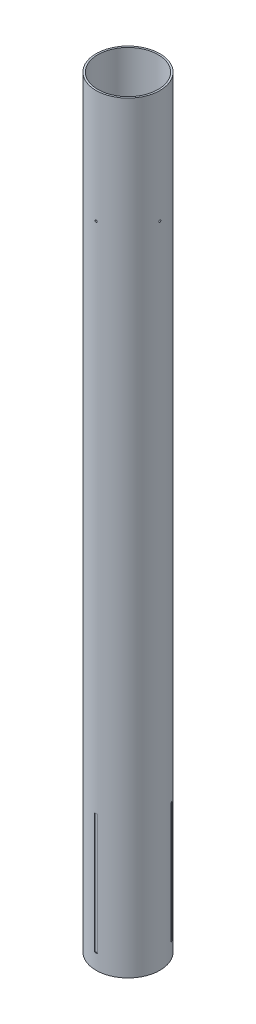
from build123d import *

# Parameters (mm, degrees)
SKETCH1_R               = 53.721
SKETCH1_R_2             = 50.8
TUBE_EXTRUSION_DEPTH    = 1282.7
ENGINE_BLOCK_HOLE_REACH = 1290.312
SKETCH2_R               = 1.6383
CIRPATTERN1_COUNT       = 4
SKETCH3_W               = 5.334
SKETCH3_H               = 203.2
FIN_SLOTS_DEPTH         = 1.27
CIRPATTERN2_COUNT       = 3


with BuildPart() as part:
    # Sketch1 → Tube Extrusion (new body)
    with BuildSketch(Plane(origin=(0, 0, 0), x_dir=(1, 0, 0), z_dir=(0, 1, 0))):
        Circle(SKETCH1_R)
        Circle(SKETCH1_R_2, mode=Mode.SUBTRACT)
    extrude(amount=TUBE_EXTRUSION_DEPTH)

    # Sketch2 → Engine Block Hole (cut, up to next)
    with BuildSketch(Plane.XY.offset(53.721), mode=Mode.PRIVATE) as engine_block_hole_sk1:
        with Locations((0, 1092.2)):
            Circle(SKETCH2_R)
    engine_block_hole_tool1 = extrude(engine_block_hole_sk1.sketch, amount=-ENGINE_BLOCK_HOLE_REACH, mode=Mode.PRIVATE) & part.part
    engine_block_hole = engine_block_hole_tool1.solids().sort_by_distance((0, 1092.2, 53.721))[0]
    add(engine_block_hole, mode=Mode.SUBTRACT)

    # CirPattern1: Engine Block Hole ×4 about axis
    cirpattern1_axis = Axis((0, 1282.7, 0), (0, -1, 0))
    for i in range(1, CIRPATTERN1_COUNT):
        add(engine_block_hole.rotate(cirpattern1_axis, i * 360 / CIRPATTERN1_COUNT), mode=Mode.SUBTRACT)

    # Sketch3 → Fin Slots (cut)
    with BuildSketch(Plane.XY.offset(53.721)):
        with Locations((0, 127)):
            Rectangle(SKETCH3_W, SKETCH3_H)
    fin_slots = extrude(amount=-FIN_SLOTS_DEPTH, mode=Mode.SUBTRACT)

    # CirPattern2: Fin Slots ×3 about axis
    cirpattern2_axis = Axis((0, 1282.7, 0), (0, -1, 0))
    for i in range(1, CIRPATTERN2_COUNT):
        add(fin_slots.rotate(cirpattern2_axis, i * 360 / CIRPATTERN2_COUNT), mode=Mode.SUBTRACT)


solid = part.part
